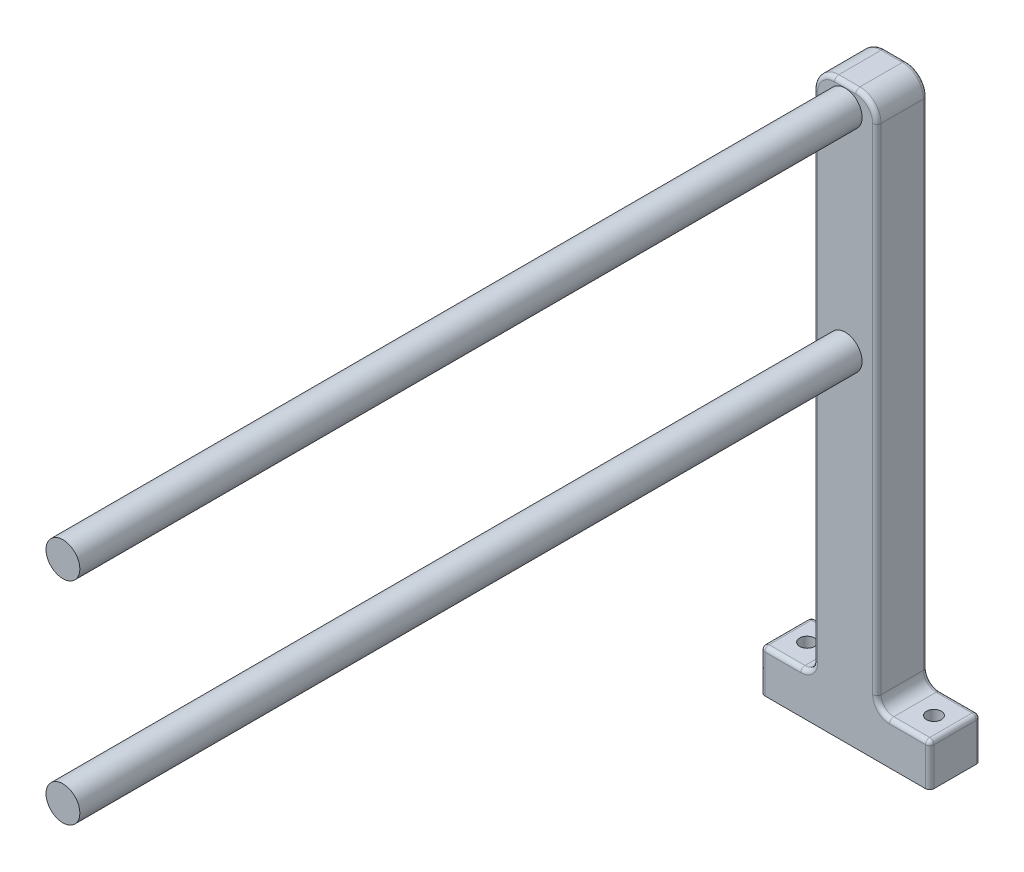
from build123d import *

# Parameters (mm, degrees)
SKETCH_1_W          = 15
SKETCH_1_H          = 135
SKETCH_1_W_2        = 40
SKETCH_1_H_2        = 10
EXTRUDE_1_DEPTH     = 12
SKETCH_2_R          = 4
EXTRUDE_2_DEPTH     = 185
SKETCH_3_R          = 1.75
CUT_EXTRUDE_1_DEPTH = 235.166607355
FILLET_1_R          = 3
FILLET_2_R          = 5
FILLET_3_R          = 1


with BuildPart() as part:
    # ｽｹｯﾁ1 → ﾎﾞｽ - 押し出し1 (new body)
    with BuildSketch(Plane.XY):
        Rectangle(SKETCH_1_W, SKETCH_1_H)
        with Locations((0, -62.5)):
            Rectangle(SKETCH_1_W_2, SKETCH_1_H_2)
    extrude(amount=EXTRUDE_1_DEPTH)

    # ｽｹｯﾁ2 → ﾎﾞｽ - 押し出し2 (add)
    with BuildSketch(Plane.XY.offset(12)):
        with Locations(Location((0, 12.5, 0), (0, 0, 180))):
            Circle(SKETCH_2_R)
        with Locations(Location((0, 62.5, 0), (0, 0, 180))):
            Circle(SKETCH_2_R)
    extrude(amount=EXTRUDE_2_DEPTH)

    # ｽｹｯﾁ3 → ｶｯﾄ - 押し出し1 (cut, through all)
    with BuildSketch(Plane(origin=(0, -57.5, 0), x_dir=(1, 0, 0), z_dir=(0, 1, 0))):
        with Locations(Location((-15, -6, 0), (0, 0, 270))):
            Circle(SKETCH_3_R)
        with Locations(Location((15, -6, 0), (0, 0, 270))):
            Circle(SKETCH_3_R)
    extrude(amount=-CUT_EXTRUDE_1_DEPTH, mode=Mode.SUBTRACT)

    # ﾌｨﾚｯﾄ1
    fillet_1_edges = [part.edges().sort_by_distance(p)[0] for p in [
        (-7.5, -57.5, 6),
        (7.5, -57.5, 6),
    ]]
    fillet(fillet_1_edges, radius=FILLET_1_R)

    # ﾌｨﾚｯﾄ2
    fillet_2_edges = [part.edges().sort_by_distance(p)[0] for p in [
        (7.5, 67.5, 6),
        (-7.5, 67.5, 6),
    ]]
    fillet(fillet_2_edges, radius=FILLET_2_R)

    # ﾌｨﾚｯﾄ3
    fillet_3_edges = [part.edges().sort_by_distance(p)[0] for p in [
        (20, -57.5, 6),
        (-20, -57.5, 6),
        (-15.25, -57.5, 12),
        (20, -62.5, 12),
        (-20, -62.5, 12),
        (-15.25, -57.5, 0),
        (20, -62.5, 0),
        (-20, -62.5, 0),
        (7.5, 4, 12),
        (7.5, 4, 0),
        (15.25, -57.5, 12),
        (15.25, -57.5, 0),
        (-7.5, 4, 12),
        (-7.5, 4, 0),
        (8.378679656, -56.621320344, 0),
        (8.378679656, -56.621320344, 12),
        (-8.378679656, -56.621320344, 0),
        (-8.378679656, -56.621320344, 12),
        (0, 67.5, 0),
        (0, 67.5, 12),
        (-6.035533906, 66.035533906, 0),
        (6.035533906, 66.035533906, 0),
        (-6.035533906, 66.035533906, 12),
        (6.035533906, 66.035533906, 12),
    ]]
    fillet(fillet_3_edges, radius=FILLET_3_R - 0.0001)  # a hair under: the kernel refuses the full size


solid = part.part
